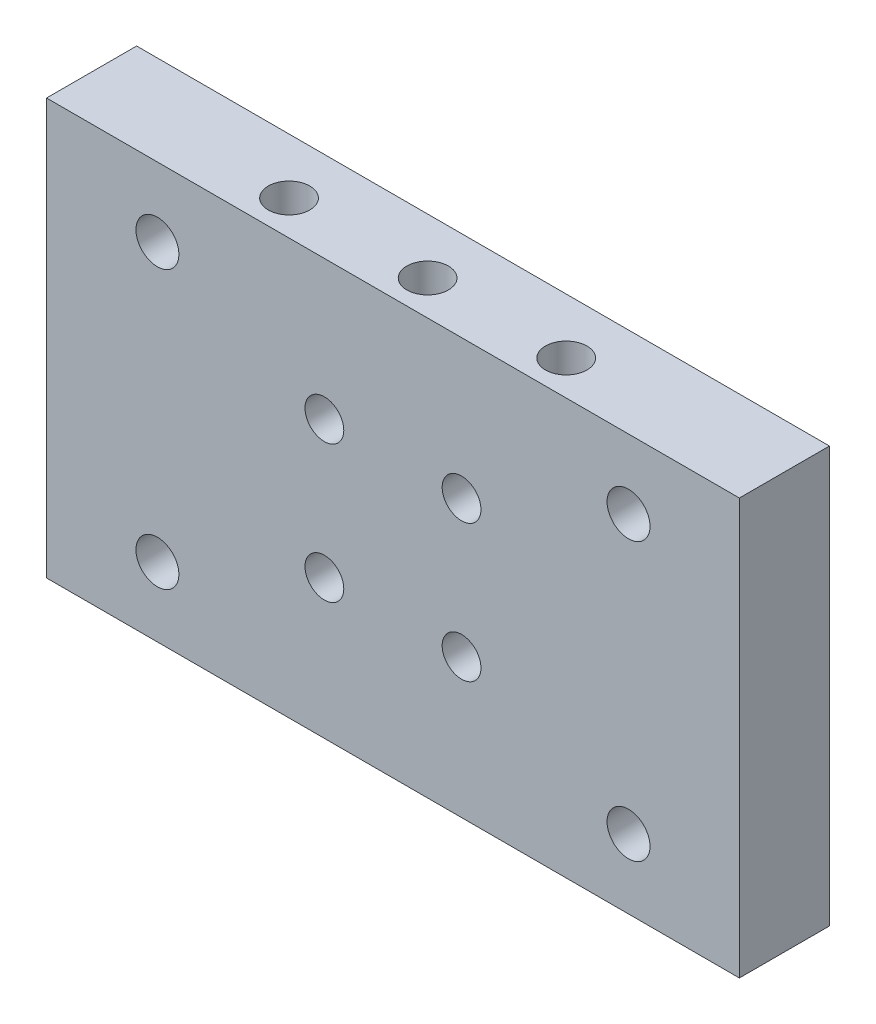
from build123d import *

# Parameters (mm, degrees)
SKETCH_1_W          = 50
SKETCH_1_H          = 30
EXTRUDE_1_DEPTH     = 6.5
SKETCH_2_R          = 1.4
CUT_EXTRUDE_1_DEPTH = 30.870554062
SKETCH_4_R          = 1.55
CUT_EXTRUDE_2_DEPTH = 30.870554062
SKETCH_5_R          = 1.5
CUT_EXTRUDE_3_DEPTH = 40.588508434


with BuildPart() as part:
    # 草图1 → 凸台-拉伸1 (new body)
    with BuildSketch(Plane.XY):
        Rectangle(SKETCH_1_W, SKETCH_1_H)
    extrude(amount=EXTRUDE_1_DEPTH)

    # 草图2 → 切除-拉伸1 (cut, through all)
    with BuildSketch(Plane.XY.offset(6.5)):
        with Locations((-4.95, -4.95)):
            Circle(SKETCH_2_R)
        with Locations((4.95, -4.95)):
            Circle(SKETCH_2_R)
        with Locations((-4.95, 4.95)):
            Circle(SKETCH_2_R)
        with Locations((4.95, 4.95)):
            Circle(SKETCH_2_R)
    extrude(amount=-CUT_EXTRUDE_1_DEPTH, mode=Mode.SUBTRACT)

    # 草图4 → 切除-拉伸2 (cut, through all)
    with BuildSketch(Plane(origin=(0, 0, 0), x_dir=(-1, 0, 0), z_dir=(0, 0, -1))):
        with Locations((-17, 10)):
            Circle(SKETCH_4_R)
        with Locations((-17, -10)):
            Circle(SKETCH_4_R)
        with Locations((17, -10)):
            Circle(SKETCH_4_R)
        with Locations((17, 10)):
            Circle(SKETCH_4_R)
    extrude(amount=-CUT_EXTRUDE_2_DEPTH, mode=Mode.SUBTRACT)

    # 草图5 → 切除-拉伸3 (cut, through all)
    with BuildSketch(Plane(origin=(0, 15, 0), x_dir=(1, 0, 0), z_dir=(0, 1, 0))):
        with Locations((-10, -4)):
            Circle(SKETCH_5_R)
        with Locations((0, -4)):
            Circle(SKETCH_5_R)
        with Locations((10, -4)):
            Circle(SKETCH_5_R)
    extrude(amount=-CUT_EXTRUDE_3_DEPTH, mode=Mode.SUBTRACT)


solid = part.part
